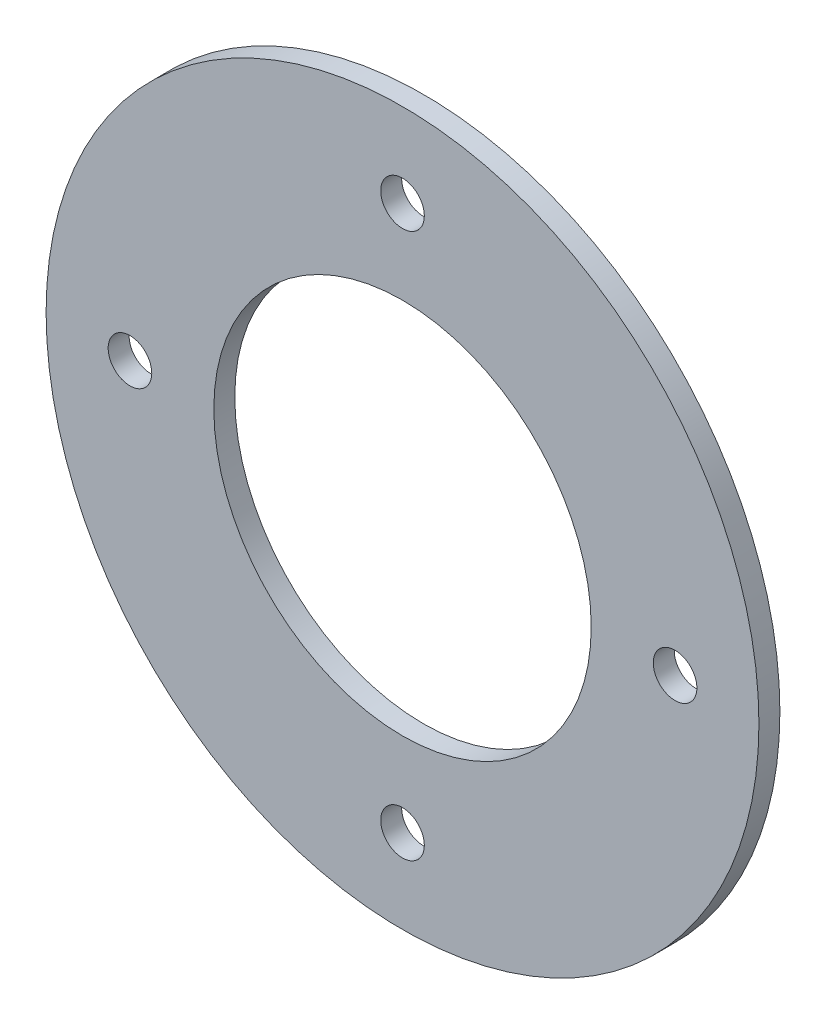
from build123d import *

# Parameters (mm, degrees)
SKETCH1_R          = 26.9875
SKETCH1_R_2        = 14.2875
BASE_FLANGE1_DEPTH = 1.5875
SKETCH6_R          = 1.651
CUT_EXTRUDE1_DEPTH = 39.199089894


# Sheet-metal steps are written as plain solids
with BuildPart() as part:
    # Sketch1 → Base-Flange1 (new body)
    with BuildSketch(Plane.XY):
        Circle(SKETCH1_R)
        Circle(SKETCH1_R_2, mode=Mode.SUBTRACT)
    extrude(amount=-BASE_FLANGE1_DEPTH)

    # Sketch6 → Cut-Extrude1 (cut, through all)
    with BuildSketch(Plane.XY):
        with Locations((0, 20.6375)):
            Circle(SKETCH6_R)
        with Locations((20.6375, 0)):
            Circle(SKETCH6_R)
        with Locations((0, -20.6375)):
            Circle(SKETCH6_R)
        with Locations((-20.6375, 0)):
            Circle(SKETCH6_R)
    extrude(amount=-CUT_EXTRUDE1_DEPTH, mode=Mode.SUBTRACT)


solid = part.part
